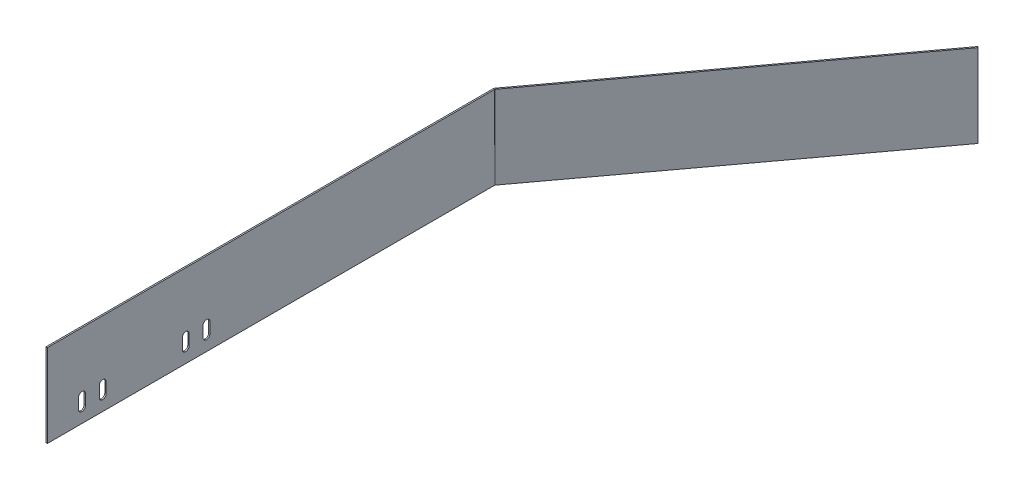
from build123d import *

# Parameters (mm, degrees)
SKETCH2_W            = 650
SKETCH2_H            = 120
BASE_FLANGE1_DEPTH   = 2
EDGE_FLANGE1_START   = -60
EDGE_FLANGE1_DEPTH   = 120
EDGE_FLANGE1_2_DEPTH = 120
CUT_EXTRUDE1_DEPTH   = 2


# Read off the part's stored shape, not the designer's step: Edge-Flange1
# Sheet-metal steps are written as plain solids
with BuildPart() as part:
    # Sketch2 → Base-Flange1 (new body)
    with BuildSketch(Plane(origin=(0, 0, 0), x_dir=(0, 0, -1), z_dir=(1, 0, 0))):
        Rectangle(SKETCH2_W, SKETCH2_H)
    extrude(amount=BASE_FLANGE1_DEPTH)

    # Edge-Flange1 outline → Edge-Flange1 (cut)
    with BuildSketch(Plane(origin=(0, 0, 0), x_dir=(1, 0, 0), z_dir=(0, 1, 0)).offset(EDGE_FLANGE1_START)):
        with BuildLine():
            ThreePointArc((0, 320.978152936), (0.201203495, 322.230808162), (0.784572558, 323.357444083))
            Line((0.784572558, 323.357444083), (2, 325))
            Line((2, 325), (0, 325))
            Line((0, 325), (0, 320.978152936))
        make_face()
    extrude(amount=EDGE_FLANGE1_DEPTH, mode=Mode.SUBTRACT)

    # Edge-Flange1 2 outline → Edge-Flange1 2 (add)
    with BuildSketch(Plane(origin=(0, 0, 0), x_dir=(1, 0, 0), z_dir=(0, 1, 0)).offset(EDGE_FLANGE1_START)):
        with BuildLine():
            Line((297.411393376, 724.225585433), (2, 325))
            Line((2, 325), (2, 320.978152936))
            ThreePointArc((2, 320.978152936), (2.100601748, 321.604480549), (2.392286279, 322.167798509))
            Line((2.392286279, 322.167798509), (299.019107097, 723.035939859))
            Line((299.019107097, 723.035939859), (297.411393376, 724.225585433))
        make_face()
    extrude(amount=EDGE_FLANGE1_2_DEPTH)

    # Sketch10 → Cut-Extrude1 (cut)
    with BuildSketch(Plane.ZY):
        with BuildLine():
            Line((280, -25), (280, -40))
            ThreePointArc((280, -40), (275, -45), (270, -40))
            Line((270, -40), (270, -25))
            ThreePointArc((270, -25), (275, -20), (280, -25))
        make_face()
        with BuildLine():
            Line((250, -25), (250, -40))
            ThreePointArc((250, -40), (245, -45), (240, -40))
            Line((240, -40), (240, -25))
            ThreePointArc((240, -25), (245, -20), (250, -25))
        make_face()
        with BuildLine():
            Line((130, -25), (130, -40))
            ThreePointArc((130, -40), (125, -45), (120, -40))
            Line((120, -40), (120, -25))
            ThreePointArc((120, -25), (125, -20), (130, -25))
        make_face()
        with BuildLine():
            Line((100, -25), (100, -40))
            ThreePointArc((100, -40), (95, -45), (90, -40))
            Line((90, -40), (90, -25))
            ThreePointArc((90, -25), (95, -20), (100, -25))
        make_face()
    extrude(amount=-CUT_EXTRUDE1_DEPTH, mode=Mode.SUBTRACT)


solid = part.part
